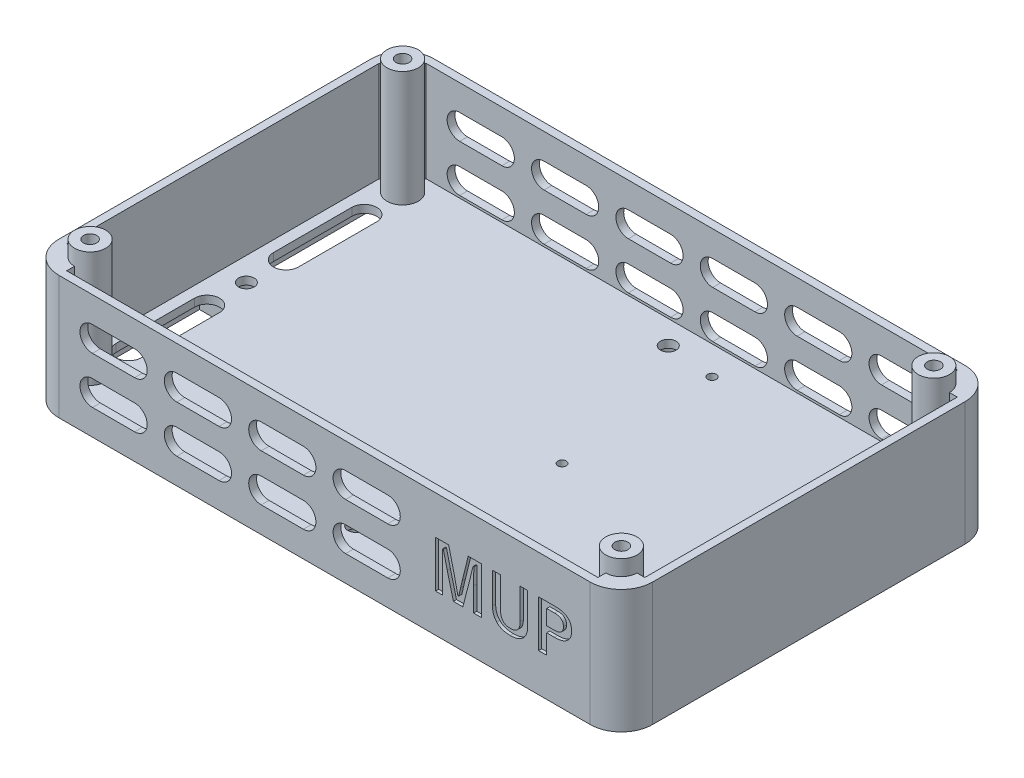
from build123d import *

# Parameters (mm, degrees)
SKETCH1_R                    = 5.5
BOSS_EXTRUDE1_DEPTH          = 5
BOSS_EXTRUDE2_DEPTH          = 2.5
BOSS_EXTRUDE4_DEPTH          = 32
F_5_0_5_DIAMETER_HOLE1_D     = 5
F_5_0_5_DIAMETER_HOLE1_DEPTH = 2.5
F_5_0_5_DIAMETER_HOLE1_TIP   = 1.502151548
SKETCH8_R                    = 5
BOSS_EXTRUDE5_DEPTH          = 5
TAP_DRILL_FOR_M5_TAP1_D      = 4.2
TAP_DRILL_FOR_M5_TAP1_DEPTH  = 20
TAP_DRILL_FOR_M5_TAP1_TIP    = 1.2618073
CUT_EXTRUDE2_DEPTH           = 2.5
SKETCH17_R                   = 1.35
SKETCH17_R_2                 = 1.404475062
CUT_EXTRUDE3_DEPTH           = 2.5
CUT_EXTRUDE4_DEPTH           = 2.5
CUT_EXTRUDE5_START           = -2.5
CUT_EXTRUDE5_DEPTH           = 2.5
CUT_EXTRUDE6_DEPTH           = 1


with BuildPart() as part:
    # Sketch1 → Boss-Extrude1 (new body)
    with BuildSketch(Plane(origin=(0, 94.5, 0), x_dir=(1, 0, 0), z_dir=(0, 1, 0))):
        with BuildLine():
            ThreePointArc((94.824063881, -94.891398577), (91.895131693, -87.820330766), (84.824063881, -84.891398577))
            Line((84.824063881, -84.891398577), (-85.175936119, -84.891398577))
            ThreePointArc((-85.175936119, -84.891398577), (-92.247003931, -87.820330766), (-95.175936119, -94.891398577))
            Line((-95.175936119, -94.891398577), (-95.175936119, -194.891398577))
            ThreePointArc((-95.175936119, -194.891398577), (-92.247003931, -201.962466389), (-85.175936119, -204.891398577))
            Line((-85.175936119, -204.891398577), (84.824063881, -204.891398577))
            ThreePointArc((84.824063881, -204.891398577), (91.895131693, -201.962466389), (94.824063881, -194.891398577))
            Line((94.824063881, -194.891398577), (94.824063881, -94.891398577))
        make_face()
        with Locations((-0.175936119, -194.891398577)):
            Circle(SKETCH1_R, mode=Mode.SUBTRACT)
        with BuildLine():
            ThreePointArc((7.324063881, -194.891398577), (-0.175936119, -187.391398577), (-7.675936119, -194.891398577))
            Line((-7.675936119, -194.891398577), (-7.675936119, -202.391398577))
            Line((-7.675936119, -202.391398577), (-85.175936119, -202.391398577))
            ThreePointArc((-85.175936119, -202.391398577), (-90.479236978, -200.194699436), (-92.675936119, -194.891398577))
            Line((-92.675936119, -194.891398577), (-92.675936119, -152.391398577))
            Line((-92.675936119, -152.391398577), (-85.175936119, -152.391398577))
            ThreePointArc((-85.175936119, -152.391398577), (-77.699334308, -144.299431209), (-86.356177266, -137.484845342))
            Line((-86.356177266, -137.484845342), (-92.675936119, -137.484845342))
            Line((-92.675936119, -137.484845342), (-92.675936119, -94.891398577))
            ThreePointArc((-92.675936119, -94.891398577), (-90.479236978, -89.588097719), (-85.175936119, -87.391398577))
            Line((-85.175936119, -87.391398577), (-7.675936119, -87.391398577))
            Line((-7.675936119, -87.391398577), (-7.675936119, -94.189123751))
            Line((-7.675936119, -94.189123751), (-7.641500232, -94.173518038))
            ThreePointArc((-7.641500232, -94.173518038), (-0.535289114, -102.382784659), (7.324063881, -94.891398577))
            Line((7.324063881, -94.891398577), (7.324063881, -87.391398577))
            Line((7.324063881, -87.391398577), (84.824063881, -87.391398577))
            ThreePointArc((84.824063881, -87.391398577), (90.12736474, -89.588097719), (92.324063881, -94.891398577))
            Line((92.324063881, -94.891398577), (92.324063881, -137.391398577))
            Line((92.324063881, -137.391398577), (84.824063881, -137.391398577))
            ThreePointArc((84.824063881, -137.391398577), (77.324063881, -144.891398577), (84.824063881, -152.391398577))
            Line((84.824063881, -152.391398577), (92.324063881, -152.391398577))
            Line((92.324063881, -152.391398577), (92.324063881, -194.891398577))
            ThreePointArc((92.324063881, -194.891398577), (90.12736474, -200.194699436), (84.824063881, -202.391398577))
            Line((84.824063881, -202.391398577), (7.324063881, -202.391398577))
            Line((7.324063881, -202.391398577), (7.324063881, -194.891398577))
        make_face(mode=Mode.SUBTRACT)
        with Locations((84.824063881, -144.891398577)):
            Circle(SKETCH1_R, mode=Mode.SUBTRACT)
        with Locations((-0.175936119, -94.891398577)):
            Circle(SKETCH1_R, mode=Mode.SUBTRACT)
        with Locations((-85.175936119, -144.891398577)):
            Circle(SKETCH1_R, mode=Mode.SUBTRACT)
    extrude(amount=BOSS_EXTRUDE1_DEPTH)

    # Sketch2 → Boss-Extrude2 (add)
    with BuildSketch(Plane(origin=(0, 99.5, 0), x_dir=(1, 0, 0), z_dir=(0, 1, 0))):
        with BuildLine():
            Line((84.824063881, -84.891398577), (-85.175936119, -84.891398577))
            ThreePointArc((-85.175936119, -84.891398577), (-92.247003931, -87.820330766), (-95.175936119, -94.891398577))
            Line((-95.175936119, -94.891398577), (-95.175936119, -194.891398577))
            ThreePointArc((-95.175936119, -194.891398577), (-92.247003931, -201.962466389), (-85.175936119, -204.891398577))
            Line((-85.175936119, -204.891398577), (84.824063881, -204.891398577))
            ThreePointArc((84.824063881, -204.891398577), (91.895131693, -201.962466389), (94.824063881, -194.891398577))
            Line((94.824063881, -194.891398577), (94.824063881, -94.891398577))
            ThreePointArc((94.824063881, -94.891398577), (91.895131693, -87.820330766), (84.824063881, -84.891398577))
        make_face()
    extrude(amount=BOSS_EXTRUDE2_DEPTH)

    # Sketch5 → Boss-Extrude4 (add)
    with BuildSketch(Plane(origin=(0, 102, 0), x_dir=(1, 0, 0), z_dir=(0, 1, 0))):
        with BuildLine():
            Line((-95.175936119, -94.891398577), (-95.175936119, -194.891398577))
            ThreePointArc((-95.175936119, -194.891398577), (-92.247003931, -201.962466389), (-85.175936119, -204.891398577))
            Line((-85.175936119, -204.891398577), (84.824063881, -204.891398577))
            ThreePointArc((84.824063881, -204.891398577), (91.895131693, -201.962466389), (94.824063881, -194.891398577))
            Line((94.824063881, -194.891398577), (94.824063881, -94.891398577))
            ThreePointArc((94.824063881, -94.891398577), (91.895131693, -87.820330766), (84.824063881, -84.891398577))
            Line((84.824063881, -84.891398577), (-85.175936119, -84.891398577))
            ThreePointArc((-85.175936119, -84.891398577), (-92.247003931, -87.820330766), (-95.175936119, -94.891398577))
        make_face()
        with BuildLine():
            Line((92.324063881, -94.891398577), (92.324063881, -194.891398577))
            Line((92.324063881, -194.891398577), (89.824063881, -194.891398577))
            ThreePointArc((89.824063881, -194.891398577), (81.288529975, -191.355864672), (84.824063881, -199.891398577))
            Line((84.824063881, -199.891398577), (84.824063881, -202.391398577))
            Line((84.824063881, -202.391398577), (-85.175936119, -202.391398577))
            Line((-85.175936119, -202.391398577), (-85.175936119, -199.891398577))
            ThreePointArc((-85.175936119, -199.891398577), (-81.640402213, -191.355864672), (-90.175936119, -194.891398577))
            Line((-90.175936119, -194.891398577), (-92.675936119, -194.891398577))
            Line((-92.675936119, -194.891398577), (-92.675936119, -94.891398577))
            Line((-92.675936119, -94.891398577), (-90.175936119, -94.891398577))
            ThreePointArc((-90.175936119, -94.891398577), (-81.640402213, -98.426932483), (-85.175936119, -89.891398577))
            Line((-85.175936119, -89.891398577), (-85.175936119, -87.391398577))
            Line((-85.175936119, -87.391398577), (84.824063881, -87.391398577))
            Line((84.824063881, -87.391398577), (84.824063881, -89.891398577))
            ThreePointArc((84.824063881, -89.891398577), (81.288529975, -98.426932483), (89.824063881, -94.891398577))
            Line((89.824063881, -94.891398577), (92.324063881, -94.891398577))
        make_face(mode=Mode.SUBTRACT)
    extrude(amount=BOSS_EXTRUDE4_DEPTH)

    # Ø5.0 (5) Diameter Hole1
    with Locations(Plane(origin=(0, 102, 0), x_dir=(1, 0, 0), z_dir=(0, 1, 0))):
        with Locations((-0.175936119, -94.891398577), (-85.175936119, -144.891398577), (84.824063881, -144.891398577), (-0.175936119, -194.891398577)):
            Hole(F_5_0_5_DIAMETER_HOLE1_D / 2, depth=F_5_0_5_DIAMETER_HOLE1_DEPTH)
            with Locations((0, 0, -(F_5_0_5_DIAMETER_HOLE1_DEPTH + F_5_0_5_DIAMETER_HOLE1_TIP / 2))):  # 118° drill point
                Cone(0, F_5_0_5_DIAMETER_HOLE1_D / 2, F_5_0_5_DIAMETER_HOLE1_TIP, mode=Mode.SUBTRACT)

    # Sketch8 → Boss-Extrude5 (add)
    with BuildSketch(Plane(origin=(0, 134, 0), x_dir=(1, 0, 0), z_dir=(0, 1, 0))):
        with Locations((-85.175936119, -194.891398577)):
            Circle(SKETCH8_R)
        with Locations((-85.175936119, -94.891398577)):
            Circle(SKETCH8_R)
        with Locations((84.824063881, -94.891398577)):
            Circle(SKETCH8_R)
        with Locations((84.824063881, -194.891398577)):
            Circle(SKETCH8_R)
    extrude(amount=BOSS_EXTRUDE5_DEPTH)

    # Tap Drill for M5 Tap1
    with Locations(Plane(origin=(0, 139, 0), x_dir=(1, 0, 0), z_dir=(0, 1, 0))):
        with Locations((-85.175936119, -94.891398577), (-85.175936119, -194.891398577), (84.824063881, -94.891398577), (84.824063881, -194.891398577)):
            Hole(TAP_DRILL_FOR_M5_TAP1_D / 2, depth=TAP_DRILL_FOR_M5_TAP1_DEPTH)
            with Locations((0, 0, -(TAP_DRILL_FOR_M5_TAP1_DEPTH + TAP_DRILL_FOR_M5_TAP1_TIP / 2))):  # 118° drill point
                Cone(0, TAP_DRILL_FOR_M5_TAP1_D / 2, TAP_DRILL_FOR_M5_TAP1_TIP, mode=Mode.SUBTRACT)

    # Sketch11 → Cut-Extrude2 (cut)
    with BuildSketch(Plane(origin=(0, 102, 0), x_dir=(1, 0, 0), z_dir=(0, 1, 0))):
        with BuildLine():
            Line((-81.140754753, -132.2652504), (-81.140754753, -107.2017198))
            ThreePointArc((-81.140754753, -107.2017198), (-85.140754753, -103.2017198), (-89.140754753, -107.2017198))
            Line((-89.140754753, -107.2017198), (-89.140754753, -132.2652504))
            ThreePointArc((-89.140754753, -132.2652504), (-85.140754753, -136.2652504), (-81.140754753, -132.2652504))
        make_face()
        with BuildLine():
            Line((-89.140754753, -182.581077355), (-89.140754753, -157.517546755))
            ThreePointArc((-89.140754753, -157.517546755), (-85.140754753, -153.517546755), (-81.140754753, -157.517546755))
            Line((-81.140754753, -157.517546755), (-81.140754753, -182.581077355))
            ThreePointArc((-81.140754753, -182.581077355), (-85.140754753, -186.581077355), (-89.140754753, -182.581077355))
        make_face()
    extrude(amount=-CUT_EXTRUDE2_DEPTH, mode=Mode.SUBTRACT)

    # Sketch17 → Cut-Extrude3 (cut)
    with BuildSketch(Plane(origin=(0, 102, 0), x_dir=(1, 0, 0), z_dir=(0, 1, 0))):
        with Locations((15.469678797, -144.526702453)):
            Circle(SKETCH17_R)
        with Locations((15.469678797, -96.526702453)):
            Circle(SKETCH17_R_2)
        with Locations((73.469678797, -144.526702453)):
            Circle(SKETCH17_R)
        with Locations((73.469678797, -96.526702453)):
            Circle(SKETCH17_R)
    extrude(amount=-CUT_EXTRUDE3_DEPTH, mode=Mode.SUBTRACT)

    # Sketch18 → Cut-Extrude4 (cut)
    with BuildSketch(Plane.XY.offset(204.891398577)):
        with BuildLine():
            Line((-74.425936119, 117.75), (-60.925936119, 117.75))
            ThreePointArc((-60.925936119, 117.75), (-56.925936119, 121.75), (-60.925936119, 125.75))
            Line((-60.925936119, 125.75), (-74.425936119, 125.75))
            ThreePointArc((-74.425936119, 125.75), (-78.425936119, 121.75), (-74.425936119, 117.75))
        make_face()
        with BuildLine():
            Line((-33.925936119, 125.75), (-47.425936119, 125.75))
            ThreePointArc((-47.425936119, 125.75), (-51.425936119, 121.75), (-47.425936119, 117.75))
            Line((-47.425936119, 117.75), (-33.925936119, 117.75))
            ThreePointArc((-33.925936119, 117.75), (-29.925936119, 121.75), (-33.925936119, 125.75))
        make_face()
        with BuildLine():
            Line((-6.925936119, 125.75), (-20.425936119, 125.75))
            ThreePointArc((-20.425936119, 125.75), (-24.425936119, 121.75), (-20.425936119, 117.75))
            Line((-20.425936119, 117.75), (-6.925936119, 117.75))
            ThreePointArc((-6.925936119, 117.75), (-2.925936119, 121.75), (-6.925936119, 125.75))
        make_face()
        with BuildLine():
            Line((20.074063881, 125.75), (6.574063881, 125.75))
            ThreePointArc((6.574063881, 125.75), (2.574063881, 121.75), (6.574063881, 117.75))
            Line((6.574063881, 117.75), (20.074063881, 117.75))
            ThreePointArc((20.074063881, 117.75), (24.074063881, 121.75), (20.074063881, 125.75))
        make_face()
        with BuildLine():
            Line((-33.925936119, 110.75), (-47.425936119, 110.75))
            ThreePointArc((-47.425936119, 110.75), (-51.425936119, 106.75), (-47.425936119, 102.75))
            Line((-47.425936119, 102.75), (-33.925936119, 102.75))
            ThreePointArc((-33.925936119, 102.75), (-29.925936119, 106.75), (-33.925936119, 110.75))
        make_face()
        with BuildLine():
            Line((-6.925936119, 110.75), (-20.425936119, 110.75))
            ThreePointArc((-20.425936119, 110.75), (-24.425936119, 106.75), (-20.425936119, 102.75))
            Line((-20.425936119, 102.75), (-6.925936119, 102.75))
            ThreePointArc((-6.925936119, 102.75), (-2.925936119, 106.75), (-6.925936119, 110.75))
        make_face()
        with BuildLine():
            Line((20.074063881, 110.75), (6.574063881, 110.75))
            ThreePointArc((6.574063881, 110.75), (2.574063881, 106.75), (6.574063881, 102.75))
            Line((6.574063881, 102.75), (20.074063881, 102.75))
            ThreePointArc((20.074063881, 102.75), (24.074063881, 106.75), (20.074063881, 110.75))
        make_face()
        with BuildLine():
            Line((-60.925936119, 110.75), (-74.425936119, 110.75))
            ThreePointArc((-74.425936119, 110.75), (-78.425936119, 106.75), (-74.425936119, 102.75))
            Line((-74.425936119, 102.75), (-60.925936119, 102.75))
            ThreePointArc((-60.925936119, 102.75), (-56.925936119, 106.75), (-60.925936119, 110.75))
        make_face()
    extrude(amount=-CUT_EXTRUDE4_DEPTH, mode=Mode.SUBTRACT)

    # Sketch19 → Cut-Extrude5 (cut)
    with BuildSketch(Plane(origin=(0, 0, 84.891398577), x_dir=(-1, 0, 0), z_dir=(0, 0, -1)).offset(CUT_EXTRUDE5_START)):
        with BuildLine():
            Line((-60.574063881, 117.75), (-74.074063881, 117.75))
            ThreePointArc((-74.074063881, 117.75), (-78.074063881, 121.75), (-74.074063881, 125.75))
            Line((-74.074063881, 125.75), (-60.574063881, 125.75))
            ThreePointArc((-60.574063881, 125.75), (-56.574063881, 121.75), (-60.574063881, 117.75))
        make_face()
        with BuildLine():
            Line((-47.074063881, 125.75), (-33.574063881, 125.75))
            ThreePointArc((-33.574063881, 125.75), (-29.574063881, 121.75), (-33.574063881, 117.75))
            Line((-33.574063881, 117.75), (-47.074063881, 117.75))
            ThreePointArc((-47.074063881, 117.75), (-51.074063881, 121.75), (-47.074063881, 125.75))
        make_face()
        with BuildLine():
            Line((-20.074063881, 125.75), (-6.574063881, 125.75))
            ThreePointArc((-6.574063881, 125.75), (-2.574063881, 121.75), (-6.574063881, 117.75))
            Line((-6.574063881, 117.75), (-20.074063881, 117.75))
            ThreePointArc((-20.074063881, 117.75), (-24.074063881, 121.75), (-20.074063881, 125.75))
        make_face()
        with BuildLine():
            Line((6.925936119, 125.75), (20.425936119, 125.75))
            ThreePointArc((20.425936119, 125.75), (24.425936119, 121.75), (20.425936119, 117.75))
            Line((20.425936119, 117.75), (6.925936119, 117.75))
            ThreePointArc((6.925936119, 117.75), (2.925936119, 121.75), (6.925936119, 125.75))
        make_face()
        with BuildLine():
            Line((33.925936119, 125.75), (47.425936119, 125.75))
            ThreePointArc((47.425936119, 125.75), (51.425936119, 121.75), (47.425936119, 117.75))
            Line((47.425936119, 117.75), (33.925936119, 117.75))
            ThreePointArc((33.925936119, 117.75), (29.925936119, 121.75), (33.925936119, 125.75))
        make_face()
        with BuildLine():
            Line((60.925936119, 125.75), (74.425936119, 125.75))
            ThreePointArc((74.425936119, 125.75), (78.425936119, 121.75), (74.425936119, 117.75))
            Line((74.425936119, 117.75), (60.925936119, 117.75))
            ThreePointArc((60.925936119, 117.75), (56.925936119, 121.75), (60.925936119, 125.75))
        make_face()
        with BuildLine():
            Line((-47.074063881, 110.75), (-33.574063881, 110.75))
            ThreePointArc((-33.574063881, 110.75), (-29.574063881, 106.75), (-33.574063881, 102.75))
            Line((-33.574063881, 102.75), (-47.074063881, 102.75))
            ThreePointArc((-47.074063881, 102.75), (-51.074063881, 106.75), (-47.074063881, 110.75))
        make_face()
        with BuildLine():
            Line((-20.074063881, 110.75), (-6.574063881, 110.75))
            ThreePointArc((-6.574063881, 110.75), (-2.574063881, 106.75), (-6.574063881, 102.75))
            Line((-6.574063881, 102.75), (-20.074063881, 102.75))
            ThreePointArc((-20.074063881, 102.75), (-24.074063881, 106.75), (-20.074063881, 110.75))
        make_face()
        with BuildLine():
            Line((6.925936119, 110.75), (20.425936119, 110.75))
            ThreePointArc((20.425936119, 110.75), (24.425936119, 106.75), (20.425936119, 102.75))
            Line((20.425936119, 102.75), (6.925936119, 102.75))
            ThreePointArc((6.925936119, 102.75), (2.925936119, 106.75), (6.925936119, 110.75))
        make_face()
        with BuildLine():
            Line((33.925936119, 110.75), (47.425936119, 110.75))
            ThreePointArc((47.425936119, 110.75), (51.425936119, 106.75), (47.425936119, 102.75))
            Line((47.425936119, 102.75), (33.925936119, 102.75))
            ThreePointArc((33.925936119, 102.75), (29.925936119, 106.75), (33.925936119, 110.75))
        make_face()
        with BuildLine():
            Line((60.925936119, 110.75), (74.425936119, 110.75))
            ThreePointArc((74.425936119, 110.75), (78.425936119, 106.75), (74.425936119, 102.75))
            Line((74.425936119, 102.75), (60.925936119, 102.75))
            ThreePointArc((60.925936119, 102.75), (56.925936119, 106.75), (60.925936119, 110.75))
        make_face()
        with BuildLine():
            Line((-74.074063881, 110.75), (-60.574063881, 110.75))
            ThreePointArc((-60.574063881, 110.75), (-56.574063881, 106.75), (-60.574063881, 102.75))
            Line((-60.574063881, 102.75), (-74.074063881, 102.75))
            ThreePointArc((-74.074063881, 102.75), (-78.074063881, 106.75), (-74.074063881, 110.75))
        make_face()
    extrude(amount=CUT_EXTRUDE5_DEPTH, mode=Mode.SUBTRACT)

    # Sketch20 → Cut-Extrude6 (cut)
    # profile 1 of 3: a face of its own
    with BuildSketch(Plane.XY.offset(204.891398577)):
        with BuildLine():
            Line((50.028199812, 121.649348958), (50.028199812, 106.75))
            Line((50.028199812, 106.75), (47.558832267, 106.75))
            Line((47.558832267, 106.75), (47.558832267, 114.282818168))
            add(Edge.make_bspline(
                [(47.558832267, 114.282818168), (47.558622189, 114.436172648), (47.558176719, 114.761360534), (47.561969644, 115.277769719), (47.564602833, 115.850537116), (47.566513533, 116.480592901), (47.573334484, 117.166975452), (47.577603646, 117.909744322), (47.587118856, 118.708828397), (47.592220604, 119.260352433), (47.594861199, 119.545813642)],
                knots=[0, 0, 0, 0, 0.699295905, 1.482855652, 2.354879395, 3.311154761, 4.355919964, 5.484935151, 6.69823724, 8, 8, 8, 8], degree=3))
            Line((47.594861199, 119.545813642), (47.323258483, 119.545813642))
            add(Edge.make_bspline(
                [(47.323258483, 119.545813642), (47.264138539, 119.282525178), (47.149191245, 118.770611699), (46.981786845, 118.025412029), (46.815932553, 117.325916242), (46.663812199, 116.668806054), (46.508508869, 116.057686186), (46.369144521, 115.488580053), (46.23352567, 114.964681128), (46.142057687, 114.630999983), (46.098274808, 114.471277195)],
                knots=[0, 0, 0, 0, 1.240476229, 2.411866029, 3.510996527, 4.545200336, 5.512368195, 6.409496292, 7.238675333, 8, 8, 8, 8], degree=3))
            Line((46.098274808, 114.471277195), (44.088969005, 106.75))
            Line((44.088969005, 106.75), (41.065310204, 106.75))
            Line((41.065310204, 106.75), (39.111433527, 114.377047681))
            add(Edge.make_bspline(
                [(39.111433527, 114.377047681), (39.103129843, 114.410307825), (39.083971532, 114.487045824), (39.051335931, 114.616540832), (39.00759563, 114.774430579), (38.966418556, 114.964358955), (38.908204736, 115.182162416), (38.849493964, 115.431458306), (38.778295007, 115.708827512), (38.704934601, 116.017047703), (38.620402734, 116.354601157), (38.533574739, 116.722957499), (38.434122805, 117.120305212), (38.334803427, 117.549265756), (38.218091141, 118.005128957), (38.103174944, 118.492794295), (37.978669728, 119.009259232), (37.892084433, 119.363843482), (37.847649464, 119.545813642)],
                knots=[0, 0, 0, 0, 0.309238681, 0.713477303, 1.204658518, 1.786810999, 2.465926404, 3.238023104, 4.097019439, 5.049008806, 6.095981555, 7.235965016, 8.462828884, 9.790811529, 11.207651633, 12.707424911, 14.310273458, 16, 16, 16, 16], degree=3))
            Line((37.847649464, 119.545813642), (37.578818205, 119.545813642))
            add(Edge.make_bspline(
                [(37.578818205, 119.545813642), (37.594984434, 118.672829208), (37.627691388, 116.906637466), (37.632045398, 115.140147409), (37.63424733, 114.246789236)],
                knots=[0, 0, 0, 0, 0.988550013, 2, 2, 2, 2], degree=3))
            Line((37.63424733, 114.246789236), (37.63424733, 106.75))
            Line((37.63424733, 106.75), (35.350567356, 106.75))
            Line((35.350567356, 106.75), (35.350567356, 121.649348958))
            Line((35.350567356, 121.649348958), (39.552095076, 121.649348958))
            Line((39.552095076, 121.649348958), (41.422828064, 114.000129627))
            add(Edge.make_bspline(
                [(41.422828064, 114.000129627), (41.525393125, 113.577247296), (41.728218504, 112.740985239), (42.013093057, 111.494564029), (42.266563211, 110.268685864), (42.42155703, 109.456984581), (42.498153101, 109.055851625)],
                knots=[0, 0, 0, 0, 1.031833331, 2.040480294, 3.03162906, 4, 4, 4, 4], degree=3))
            Line((42.498153101, 109.055851625), (42.769755816, 109.055851625))
            add(Edge.make_bspline(
                [(42.769755816, 109.055851625), (42.784685806, 109.114939581), (42.818224688, 109.247675376), (42.869889711, 109.467791717), (42.930430883, 109.729548406), (43.004288077, 110.030788265), (43.079650818, 110.375393241), (43.169769938, 110.760085245), (43.266286241, 111.187002688), (43.333323734, 111.48548647), (43.368390373, 111.641620333)],
                knots=[0, 0, 0, 0, 0.551068972, 1.237927009, 2.044362201, 2.980423873, 4.042320384, 5.233810277, 6.553033984, 8, 8, 8, 8], degree=3))
            add(Edge.make_bspline(
                [(43.368390373, 111.641620333), (43.418809602, 111.865274455), (43.515353992, 112.293534689), (43.65943155, 112.903988638), (43.792208972, 113.453737293), (43.879019923, 113.798797007), (43.919910172, 113.961329239)],
                knots=[0, 0, 0, 0, 1.153804436, 2.209342502, 3.156553064, 4, 4, 4, 4], degree=3))
            Line((43.919910172, 113.961329239), (45.818357724, 121.649348958))
            Line((45.818357724, 121.649348958), (50.028199812, 121.649348958))
        make_face()
    # profile 2 of 3: a face of its own
    with BuildSketch(Plane.XY.offset(204.891398577)):
        with BuildLine():
            Line((64.863805276, 121.649348958), (64.863805276, 111.843936642))
            add(Edge.make_bspline(
                [(64.863805276, 111.843936642), (64.858661925, 111.615491623), (64.848674607, 111.171898879), (64.766412552, 110.528152853), (64.636494443, 109.927326624), (64.446897332, 109.370191371), (64.202175536, 108.858091575), (63.905811374, 108.387656708), (63.557492051, 107.957650881), (63.281291345, 107.714502107), (63.142730926, 107.592522709)],
                knots=[0, 0, 0, 0, 1.155203694, 2.243165468, 3.277180102, 4.259922972, 5.213054084, 6.141345898, 7.067576999, 8, 8, 8, 8], degree=3))
            add(Edge.make_bspline(
                [(63.142730926, 107.592522709), (63.01901123, 107.496475736), (62.76953855, 107.302803295), (62.356544394, 107.060302162), (61.91398425, 106.855745386), (61.441789738, 106.684040759), (60.937123051, 106.556792891), (60.402876145, 106.461787774), (59.837548686, 106.406460064), (59.450348409, 106.399054647), (59.25160631, 106.395253596)],
                knots=[0, 0, 0, 0, 0.904265754, 1.823392779, 2.759552219, 3.718639323, 4.722025448, 5.762865249, 6.85172382, 8, 8, 8, 8], degree=3))
            add(Edge.make_bspline(
                [(59.25160631, 106.395253596), (59.022281136, 106.399900105), (58.576306618, 106.40893629), (57.928613188, 106.482908112), (57.321321368, 106.597745029), (56.758612918, 106.773315058), (56.233917415, 106.98629137), (55.75505671, 107.255016959), (55.315301432, 107.568816667), (55.059163973, 107.817300611), (54.93090597, 107.9417262)],
                knots=[0, 0, 0, 0, 1.166146637, 2.267835116, 3.311979242, 4.304904815, 5.261355704, 6.186973198, 7.092146861, 8, 8, 8, 8], degree=3))
            add(Edge.make_bspline(
                [(54.93090597, 107.9417262), (54.822733326, 108.06228269), (54.606139791, 108.303672334), (54.331187601, 108.709838168), (54.100800917, 109.150335733), (53.912939193, 109.624663378), (53.762067339, 110.130553745), (53.65770455, 110.671702973), (53.597416904, 111.246696748), (53.588533867, 111.641475248), (53.583978219, 111.843936642)],
                knots=[0, 0, 0, 0, 0.917634974, 1.837375834, 2.772312225, 3.731458423, 4.725945822, 5.761527054, 6.852003457, 8, 8, 8, 8], degree=3))
            Line((53.583978219, 111.843936642), (53.583978219, 121.649348958))
            Line((53.583978219, 121.649348958), (56.164204015, 121.649348958))
            Line((56.164204015, 121.649348958), (56.164204015, 111.871651204))
            add(Edge.make_bspline(
                [(56.164204015, 111.871651204), (56.165618507, 111.730189827), (56.168360907, 111.455926171), (56.209848002, 111.058077369), (56.26799341, 110.686972843), (56.354479874, 110.342895604), (56.464535766, 110.027339361), (56.597925529, 109.737292767), (56.758995, 109.475820496), (56.945806208, 109.242023884), (57.154968222, 109.034013584), (57.390879586, 108.856236202), (57.648980942, 108.70172102), (57.935424813, 108.581452303), (58.242877378, 108.482911735), (58.576961275, 108.418743164), (58.93360825, 108.375709153), (59.18033482, 108.370966133), (59.307035436, 108.368530467)],
                knots=[0, 0, 0, 0, 1.258028535, 2.439050939, 3.555223008, 4.597849401, 5.590891407, 6.524928811, 7.432813323, 8.315990141, 9.182017763, 10.050032448, 10.938129722, 11.851208549, 12.807865492, 13.805692453, 14.873165063, 16, 16, 16, 16], degree=3))
            add(Edge.make_bspline(
                [(59.307035436, 108.368530467), (59.433735937, 108.370966244), (59.680462283, 108.37570948), (60.037110833, 108.418741969), (60.371189261, 108.482915827), (60.678660881, 108.581437974), (60.96503793, 108.701771289), (61.223377961, 108.856055739), (61.458949632, 109.035070052), (61.67132965, 109.240107223), (61.854616053, 109.476944809), (62.016358403, 109.737115129), (62.149473367, 110.027390835), (62.259608868, 110.342880705), (62.346072203, 110.686977228), (62.404224402, 111.058076091), (62.445709543, 111.455926523), (62.448452221, 111.730189947), (62.449866857, 111.871651204)],
                knots=[0, 0, 0, 0, 1.126780836, 2.194202194, 3.191981247, 4.14859226, 5.061627248, 5.949681883, 6.817654893, 7.689510776, 8.56754354, 9.475384464, 10.409377022, 11.40237135, 12.444947685, 13.561066165, 14.742031865, 16, 16, 16, 16], degree=3))
            Line((62.449866857, 111.871651204), (62.449866857, 121.649348958))
            Line((62.449866857, 121.649348958), (64.863805276, 121.649348958))
        make_face()
    # profile 3 of 3: a face of its own
    with BuildSketch(Plane.XY.offset(204.891398577)):
        with BuildLine():
            Line((68.341982907, 121.649348958), (73.5911211, 121.649348958))
            add(Edge.make_bspline(
                [(73.5911211, 121.649348958), (73.805559213, 121.646434018), (74.220271665, 121.640796672), (74.821846822, 121.589690609), (75.382775416, 121.509464131), (75.902121074, 121.389347429), (76.381342466, 121.241139704), (76.820056253, 121.059133886), (77.214754768, 120.838672842), (77.571581218, 120.589069432), (77.883911344, 120.301337696), (78.154037378, 119.98051769), (78.384865653, 119.627649765), (78.569217569, 119.238889995), (78.71826521, 118.818726462), (78.817345816, 118.363282668), (78.88433595, 117.876619382), (78.89000144, 117.54044696), (78.892916963, 117.367449007)],
                knots=[0, 0, 0, 0, 1.320629909, 2.554031376, 3.716113473, 4.808001367, 5.833865001, 6.803000249, 7.727679346, 8.613438602, 9.479306404, 10.335414512, 11.19087937, 12.068946363, 12.979598988, 13.930741538, 14.935137279, 16, 16, 16, 16], degree=3))
            add(Edge.make_bspline(
                [(78.892916963, 117.367449007), (78.888462833, 117.187017398), (78.879787915, 116.835606602), (78.802888877, 116.326659512), (78.682312476, 115.850922318), (78.509446822, 115.408015979), (78.284107198, 114.999445307), (78.010122494, 114.625394743), (77.688182399, 114.283550533), (77.439751456, 114.090278703), (77.313186883, 113.991815258)],
                knots=[0, 0, 0, 0, 1.115735908, 2.173020832, 3.176697313, 4.146807987, 5.106116177, 6.054980975, 7.009098879, 8, 8, 8, 8], degree=3))
            add(Edge.make_bspline(
                [(77.313186883, 113.991815258), (77.191910202, 113.909730187), (76.944950356, 113.742577554), (76.538277308, 113.537753956), (76.100902219, 113.361708415), (75.630024263, 113.221695145), (75.126997285, 113.111308878), (74.590976816, 113.031211406), (74.021534328, 112.98439187), (73.630933528, 112.977982), (73.430376636, 112.974690804)],
                knots=[0, 0, 0, 0, 0.861045499, 1.75337634, 2.67306046, 3.632752096, 4.640500096, 5.701522451, 6.819829568, 8, 8, 8, 8], degree=3))
            Line((73.430376636, 112.974690804), (70.924980159, 112.974690804))
            Line((70.924980159, 112.974690804), (70.924980159, 106.75))
            Line((70.924980159, 106.75), (68.341982907, 106.75))
            Line((68.341982907, 106.75), (68.341982907, 121.649348958))
        make_face()
        with BuildLine():
            Line((70.924980159, 119.714872475), (70.924980159, 114.909167287))
            Line((70.924980159, 114.909167287), (73.355547316, 114.909167287))
            add(Edge.make_bspline(
                [(73.355547316, 114.909167287), (73.47388198, 114.910122262), (73.703589929, 114.911976034), (74.03567506, 114.944479475), (74.345297116, 114.989895622), (74.631850724, 115.056251751), (74.896440047, 115.141813807), (75.139120945, 115.247007064), (75.358303999, 115.371688183), (75.556062028, 115.514033857), (75.727841965, 115.677847624), (75.876126696, 115.861301012), (76.006172977, 116.061329843), (76.106438624, 116.284703666), (76.189013063, 116.524569892), (76.241172455, 116.783768157), (76.280376199, 117.06048245), (76.283407852, 117.251814189), (76.284976604, 117.350820269)],
                knots=[0, 0, 0, 0, 1.300814759, 2.525105315, 3.665995331, 4.740489915, 5.755760999, 6.720302507, 7.644008874, 8.523934203, 9.393475176, 10.245569002, 11.113624848, 12.009131461, 12.931216062, 13.897681952, 14.912139354, 16, 16, 16, 16], degree=3))
            add(Edge.make_bspline(
                [(76.284976604, 117.350820269), (76.282961299, 117.446075438), (76.279035058, 117.631652696), (76.245394927, 117.900736831), (76.190770098, 118.151649325), (76.112549627, 118.383957196), (76.013140985, 118.598379467), (75.890529829, 118.794224978), (75.744329425, 118.970327946), (75.577537637, 119.129347259), (75.387365177, 119.268713205), (75.174434585, 119.387676902), (74.941627647, 119.490076971), (74.686514227, 119.574038273), (74.408685983, 119.635885553), (74.108893112, 119.683324354), (73.786571229, 119.711032049), (73.564384249, 119.713565621), (73.44977683, 119.714872475)],
                knots=[0, 0, 0, 0, 1.081844181, 2.10766175, 3.075292602, 3.994646757, 4.886758323, 5.754521608, 6.611876847, 7.480464852, 8.366318952, 9.282792992, 10.246145426, 11.251791674, 12.328737375, 13.47620041, 14.69818583, 16, 16, 16, 16], degree=3))
            Line((73.44977683, 119.714872475), (70.924980159, 119.714872475))
        make_face(mode=Mode.SUBTRACT)
    extrude(amount=-CUT_EXTRUDE6_DEPTH, mode=Mode.SUBTRACT)


solid = part.part
